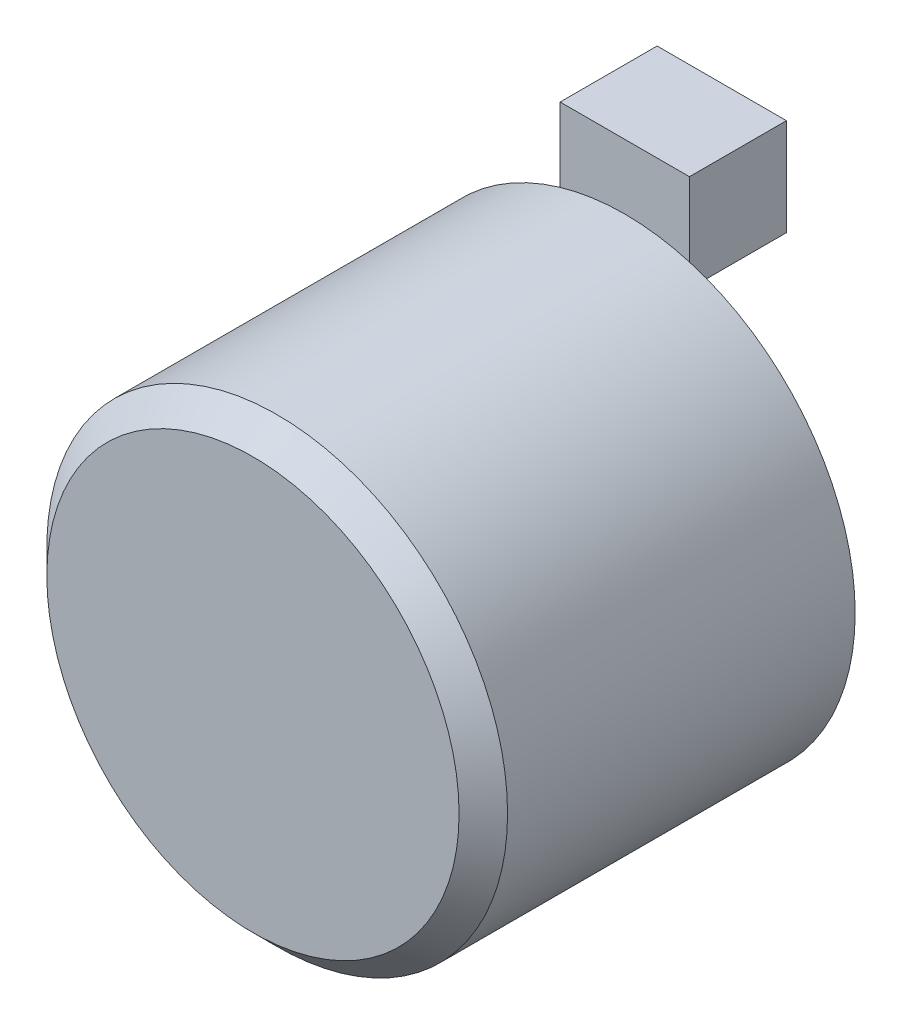
from build123d import *

# Parameters (mm, degrees)
SK_REARHOLE_R           = 1.25
REAR_TAPPED_HOLE_DEPTH  = 8
REAR_HOLE_PATTERN_COUNT = 4
SK_CONNECTOR_W          = 16
SK_CONNECTOR_H          = 12
CONNECTOR_ZONE_DEPTH    = 12


with BuildPart() as part:
    # SK_Body → Housing_Body (revolve)
    with BuildSketch(Plane(origin=(0, 0, 0), x_dir=(1, 0, 0), z_dir=(0, 1, 0))):
        Polygon((0, 0), (25.5, 0), (28.5, 3), (28.5, 46), (25.5, 46), (0, 46), align=None)
    revolve(axis=Axis((0, 0, 10), (0, 0, -1)))

    # SK_RearHole → Rear_Tapped_Hole (cut)
    with BuildSketch(Plane.XY.offset(-46)):
        with Locations((23, 0)):
            Circle(SK_REARHOLE_R)
    rear_tapped_hole = extrude(amount=REAR_TAPPED_HOLE_DEPTH, mode=Mode.SUBTRACT)

    # Rear_Hole_Pattern: Rear_Tapped_Hole ×4 about axis
    rear_hole_pattern_axis = Axis((0, 0, -60.9), (0, 0, 1))
    for i in range(1, REAR_HOLE_PATTERN_COUNT):
        add(rear_tapped_hole.rotate(rear_hole_pattern_axis, i * 360 / REAR_HOLE_PATTERN_COUNT), mode=Mode.SUBTRACT)

    # SK_Connector → Connector_Zone (add)
    with BuildSketch(Plane.XY.offset(-46)):
        with Locations((0, 30.5)):
            Rectangle(SK_CONNECTOR_W, SK_CONNECTOR_H)
    extrude(amount=-CONNECTOR_ZONE_DEPTH)


solid = part.part
